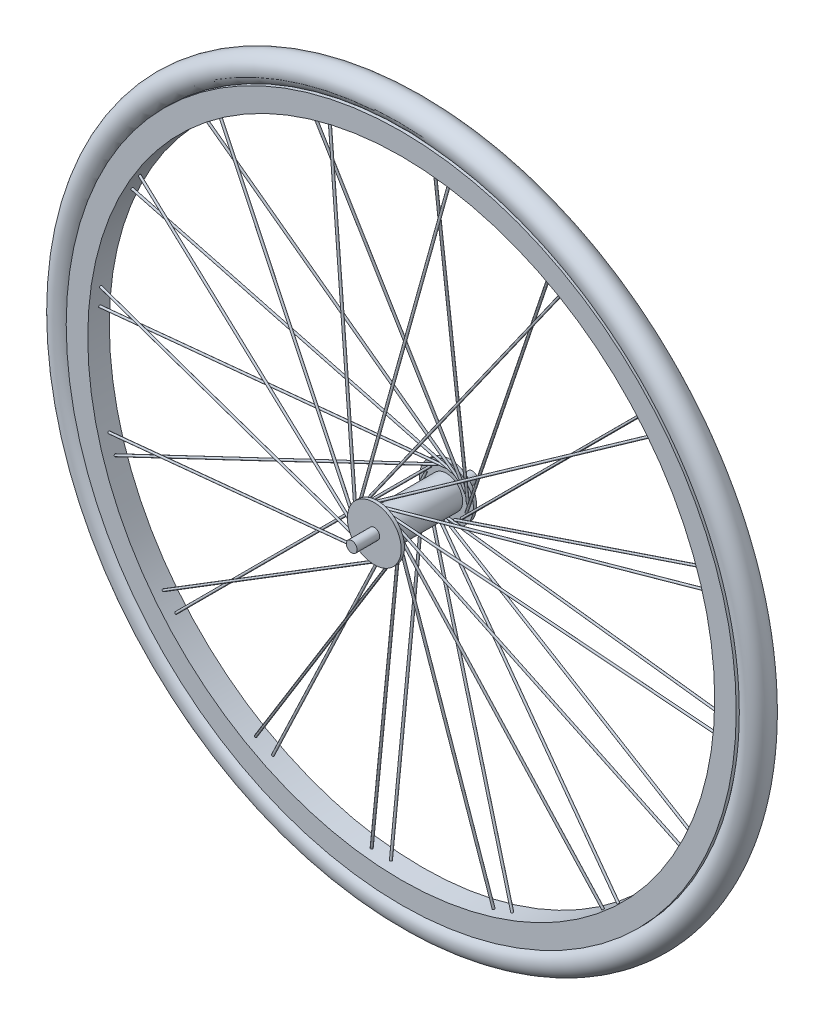
from build123d import *

# Parameters (mm, degrees)
EJE_DEPTH                = 106
EJE_DEPTH_BACK           = 6
SK_EJE_R                 = 5
BUJE_START               = 15
SK_BUJE_R                = 15
BUJE_DEPTH               = 70
PESTANA_IZQ_START        = 15
SK_PESTANA_IZQ_R         = 25
PESTANA_IZQ_DEPTH        = 3
PESTANA_DCHA_START       = 82
SK_PESTANA_DCHA_R        = 25
PESTANA_DCHA_DEPTH       = 3
LLANTA_START             = 40
SK_LLANTA_R              = 311
SK_LLANTA_R_2            = 291
LLANTA_DEPTH             = 20
SK_CUBIERTA_R            = 12.5
SK_RADIO_IZQ_R           = 1
RADIO_IZQ_DEPTH          = 148.030725636
MATRIZ_RADIOS_IZQ_COUNT  = 16
SK_RADIO_DCHA_R          = 1
RADIO_DCHA_DEPTH         = 148.029038929
MATRIZ_RADIOS_DCHA_COUNT = 16


with BuildPart() as part:
    # Sk_Eje → Eje (new, two sides: drawn at the far end of the back side and taken through both)
    with BuildSketch(Plane.XY.offset(-EJE_DEPTH_BACK)):
        Circle(SK_EJE_R)
    extrude(amount=EJE_DEPTH + EJE_DEPTH_BACK)

    # Sk_Buje → Buje (add)
    with BuildSketch(Plane.XY.offset(BUJE_START)):
        Circle(SK_BUJE_R)
    extrude(amount=BUJE_DEPTH)

    # Sk_Pestana_izq → Pestana_izq (add)
    with BuildSketch(Plane.XY.offset(PESTANA_IZQ_START)):
        Circle(SK_PESTANA_IZQ_R)
    extrude(amount=PESTANA_IZQ_DEPTH)

    # Sk_Pestana_dcha → Pestana_dcha (add)
    with BuildSketch(Plane.XY.offset(PESTANA_DCHA_START)):
        Circle(SK_PESTANA_DCHA_R)
    extrude(amount=PESTANA_DCHA_DEPTH)



with BuildPart() as body_2:
    # Sk_Llanta → Llanta (new body)
    with BuildSketch(Plane.XY.offset(LLANTA_START)):
        Circle(SK_LLANTA_R)
        Circle(SK_LLANTA_R_2, mode=Mode.SUBTRACT)
    extrude(amount=LLANTA_DEPTH)

    # Sk_Cubierta → Cubierta (revolve)
    with BuildSketch(Plane(origin=(0, 0, 0), x_dir=(1, 0, 0), z_dir=(0, 1, 0))):
        with Locations((321.5, -50)):
            Circle(SK_CUBIERTA_R)
    revolve(axis=Axis((0, 0, -950), (0, 0, 1)))


with BuildPart() as part_1:
    add(part.part)

    add(body_2.part)  # Radio_izq merges body 2
    # Sk_Radio_izq → Radio_izq (add, symmetric)
    with BuildSketch(Plane(origin=(-147.1635, 20, 34), x_dir=(0.10808566891287825, 0, 0.9941415835662724), z_dir=(-0.9941415835662724, 0, 0.10808566891287825))):
        Circle(SK_RADIO_IZQ_R)
    radio_izq = extrude(amount=RADIO_IZQ_DEPTH, both=True)

    # Matriz_radios_izq: Radio_izq ×16 about axis
    matriz_radios_izq_axis = Axis((0, 0, -500), (0, 0, 1))
    for i in range(1, MATRIZ_RADIOS_IZQ_COUNT):
        add(radio_izq.rotate(matriz_radios_izq_axis, i * 360 / MATRIZ_RADIOS_IZQ_COUNT))

    # Sk_Radio_dcha → Radio_dcha (add, symmetric)
    with BuildSketch(Plane(origin=(148.236, -9.0945, 66), x_dir=(-0.10600994510449067, 0.02108719032883783, -0.9941414496654781), z_dir=(0.9750384184363042, -0.19395180977812243, -0.10808690048762505))):
        Circle(SK_RADIO_DCHA_R)
    radio_dcha = extrude(amount=RADIO_DCHA_DEPTH, both=True)

    # Matriz_radios_dcha: Radio_dcha ×16 about axis
    matriz_radios_dcha_axis = Axis((0, 0, -500), (0, 0, 1))
    for i in range(1, MATRIZ_RADIOS_DCHA_COUNT):
        add(radio_dcha.rotate(matriz_radios_dcha_axis, i * 360 / MATRIZ_RADIOS_DCHA_COUNT))


solid = part_1.part
